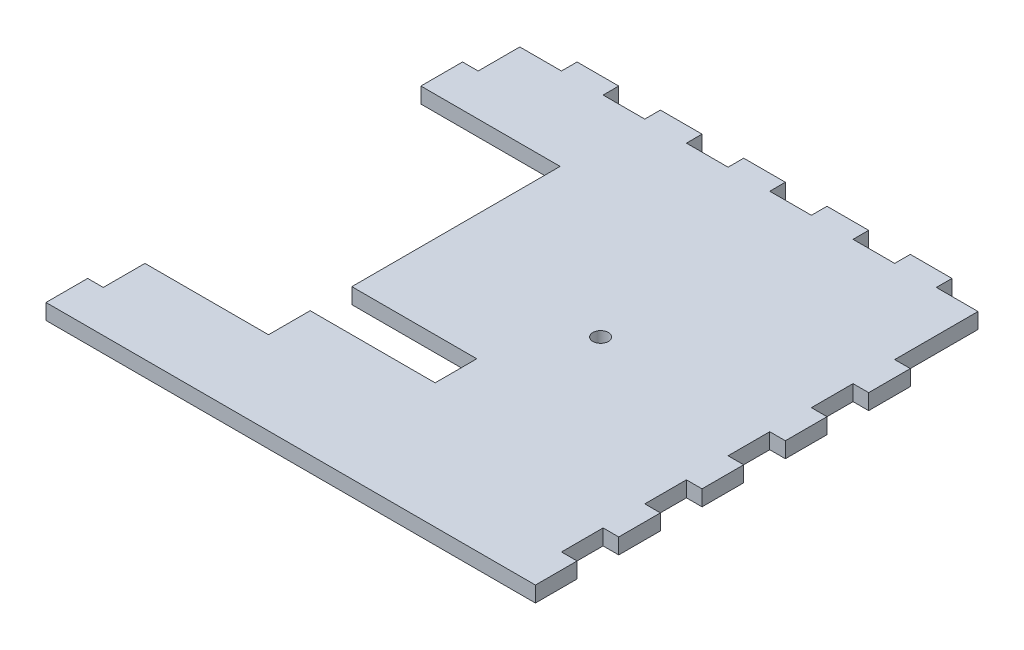
from build123d import *

# Parameters (mm, degrees)
SKETCH1_W               = 279.4
SKETCH1_H               = 279.4
BOSS_EXTRUDE1_DEPTH     = 9.525
SKETCH2_W               = 25.4
SKETCH2_H               = 9.525
BOSS_EXTRUDE2_DEPTH     = 9.525
LPATTERN1_COUNT         = 5
LPATTERN1_PITCH         = 50.8
MIRROR1_COPY_1_SKETCH_W = 25.4
MIRROR1_COPY_1_SKETCH_H = 9.525
MIRROR1_COPY_1_DEPTH    = 9.525
MIRROR1_COPY_2_SKETCH_W = 25.4
MIRROR1_COPY_2_SKETCH_H = 9.525
MIRROR1_COPY_2_DEPTH    = 9.525
MIRROR1_COPY_3_SKETCH_W = 25.4
MIRROR1_COPY_3_SKETCH_H = 9.525
MIRROR1_COPY_3_DEPTH    = 9.525
MIRROR1_COPY_4_SKETCH_W = 25.4
MIRROR1_COPY_4_SKETCH_H = 9.525
MIRROR1_COPY_4_DEPTH    = 9.525
MIRROR1_COPY_5_SKETCH_W = 25.4
MIRROR1_COPY_5_SKETCH_H = 9.525
MIRROR1_COPY_5_DEPTH    = 9.525
SKETCH3_W               = 25.4
SKETCH3_H               = 9.525
BOSS_EXTRUDE3_DEPTH     = 9.525
LPATTERN2_COUNT         = 5
LPATTERN2_PITCH         = 50.8
SKETCH6_R               = 4.7625
CUT_EXTRUDE1_DEPTH      = 212.250862424
SKETCH8_W               = 84.891093183
SKETCH8_H               = 177.8
CUT_EXTRUDE3_DEPTH      = 212.250862424
SKETCH9_W               = 25.4
SKETCH9_H               = 9.525
BOSS_EXTRUDE4_DEPTH     = 9.525
SKETCH11_W              = 25.4
SKETCH11_H              = 9.525
CUT_EXTRUDE4_DEPTH      = 76.2


with BuildPart() as part:
    # Sketch1 → Boss-Extrude1 (new body)
    with BuildSketch(Plane(origin=(0, 0, 0), x_dir=(1, 0, 0), z_dir=(0, 1, 0))):
        Rectangle(SKETCH1_W, SKETCH1_H)
    extrude(amount=BOSS_EXTRUDE1_DEPTH)

    # Sketch2 → Boss-Extrude2 (add)
    with BuildSketch(Plane(origin=(139.7, 0, 0), x_dir=(0, 0, -1), z_dir=(1, 0, 0))):
        with Locations((-127, 4.7625)):
            Rectangle(SKETCH2_W, SKETCH2_H)
    boss_extrude2 = extrude(amount=BOSS_EXTRUDE2_DEPTH)

    # LPattern1: Boss-Extrude2 ×5
    with Locations(*[(0, 0, -i * LPATTERN1_PITCH) for i in range(1, LPATTERN1_COUNT)]):
        add(boss_extrude2)

    # Mirror1 copy 1 sketch → Mirror1 copy 1 (add)
    with BuildSketch(Plane(origin=(-139.7, 0, -50.8), x_dir=(0, 0, -1), z_dir=(-1, 0, 0))):
        with Locations((-127, -4.7625)):
            Rectangle(MIRROR1_COPY_1_SKETCH_W, MIRROR1_COPY_1_SKETCH_H)
    extrude(amount=MIRROR1_COPY_1_DEPTH)

    # Mirror1 copy 2 sketch → Mirror1 copy 2 (add)
    with BuildSketch(Plane(origin=(-139.7, 0, -101.6), x_dir=(0, 0, -1), z_dir=(-1, 0, 0))):
        with Locations((-127, -4.7625)):
            Rectangle(MIRROR1_COPY_2_SKETCH_W, MIRROR1_COPY_2_SKETCH_H)
    extrude(amount=MIRROR1_COPY_2_DEPTH)

    # Mirror1 copy 3 sketch → Mirror1 copy 3 (add)
    with BuildSketch(Plane(origin=(-139.7, 0, -152.4), x_dir=(0, 0, -1), z_dir=(-1, 0, 0))):
        with Locations((-127, -4.7625)):
            Rectangle(MIRROR1_COPY_3_SKETCH_W, MIRROR1_COPY_3_SKETCH_H)
    extrude(amount=MIRROR1_COPY_3_DEPTH)

    # Mirror1 copy 4 sketch → Mirror1 copy 4 (add)
    with BuildSketch(Plane(origin=(-139.7, 0, -203.2), x_dir=(0, 0, -1), z_dir=(-1, 0, 0))):
        with Locations((-127, -4.7625)):
            Rectangle(MIRROR1_COPY_4_SKETCH_W, MIRROR1_COPY_4_SKETCH_H)
    extrude(amount=MIRROR1_COPY_4_DEPTH)

    # Mirror1 copy 5 sketch → Mirror1 copy 5 (add)
    with BuildSketch(Plane(origin=(-139.7, 0, 0), x_dir=(0, 0, -1), z_dir=(-1, 0, 0))):
        with Locations((-127, -4.7625)):
            Rectangle(MIRROR1_COPY_5_SKETCH_W, MIRROR1_COPY_5_SKETCH_H)
    extrude(amount=MIRROR1_COPY_5_DEPTH)

    # Sketch3 → Boss-Extrude3 (add)
    with BuildSketch(Plane(origin=(0, 0, -139.7), x_dir=(-1, 0, 0), z_dir=(0, 0, -1))):
        with Locations((-101.6, 4.7625)):
            Rectangle(SKETCH3_W, SKETCH3_H)
    boss_extrude3 = extrude(amount=BOSS_EXTRUDE3_DEPTH)

    # LPattern2: Boss-Extrude3 ×5
    with Locations(*[(-i * LPATTERN2_PITCH, 0, 0) for i in range(1, LPATTERN2_COUNT)]):
        add(boss_extrude3)

    # Sketch6 → Cut-Extrude1 (cut, through all)
    with BuildSketch(Plane(origin=(0, 9.525, 0), x_dir=(1, 0, 0), z_dir=(0, 1, 0))):
        with Locations((38.1, 11.176)):
            Circle(SKETCH6_R)
    extrude(amount=-CUT_EXTRUDE1_DEPTH, mode=Mode.SUBTRACT)

    # Sketch8 → Cut-Extrude3 (cut, through all)
    with BuildSketch(Plane(origin=(0, 9.525, 0), x_dir=(1, 0, 0), z_dir=(0, 1, 0))):
        with Locations((-106.779453409, 0)):
            Rectangle(SKETCH8_W, SKETCH8_H)
    extrude(amount=-CUT_EXTRUDE3_DEPTH, mode=Mode.SUBTRACT)

    # Sketch9 → Boss-Extrude4 (add)
    with BuildSketch(Plane.ZY.offset(139.7)):
        with Locations((-101.6, 4.7625)):
            Rectangle(SKETCH9_W, SKETCH9_H)
    extrude(amount=BOSS_EXTRUDE4_DEPTH)

    # Sketch11 → Cut-Extrude4 (cut)
    with BuildSketch(Plane.ZY.offset(64.333906817)):
        with Locations((50.8, 4.7625)):
            Rectangle(SKETCH11_W, SKETCH11_H)
    extrude(amount=-CUT_EXTRUDE4_DEPTH, mode=Mode.SUBTRACT)


solid = part.part
